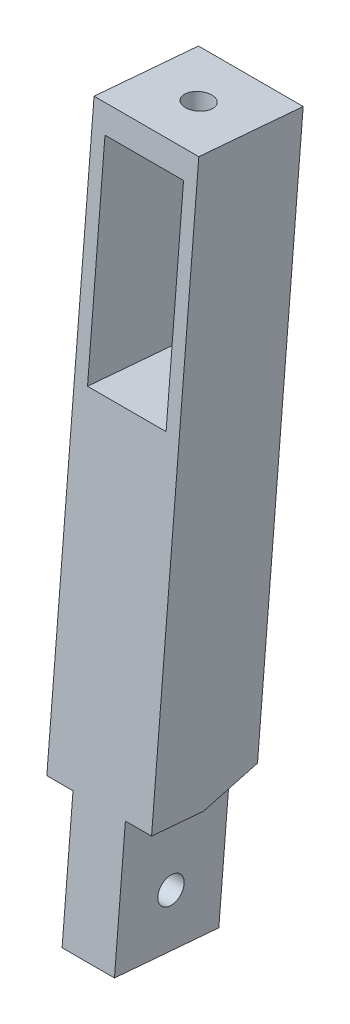
from build123d import *

# Parameters (mm, degrees)
BOSS_EXTRUDE7_START                  = 3.81
SKETCH31_W                           = 68.725
SKETCH31_H                           = 12.7
SKETCH31_W_2                         = 25.4
SKETCH31_H_2                         = 9.525
SKETCH31_W_3                         = 15.875
SKETCH31_H_3                         = 6.35
BOSS_EXTRUDE7_DEPTH                  = 12.7
M3_CLEARANCE_HOLE4_D                 = 3.2
CUT_EXTRUDE3_START                   = 6.35
CUT_EXTRUDE3_DEPTH                   = 3.175
CUT_EXTRUDE4_START                   = -6.35
CUT_EXTRUDE4_DEPTH                   = 3.175
BALL_START                           = 44.54897704
BALL_BALANCER_MASTER_MODEL_OUTLINE_R = 1.6
BALL_BALANCER_MASTER_MODEL_DEPTH     = 3.175


# Read off the part's stored shape, not the designer's step: Ball Balancer Master Model
with BuildPart() as part:
    # Sketch31 → Boss-Extrude7 (new body)
    # profile 1 of 2: a face of its own
    with BuildSketch(Plane(origin=(0, 9.162503731, 109.526818173), x_dir=(0, 0.9965191508346533, -0.08336415308621317), z_dir=(0, 0.08336415308621317, 0.9965191508346533)).offset(BOSS_EXTRUDE7_START)):
        with Locations((13.36147704, 0)):
            Rectangle(SKETCH31_W, SKETCH31_H)
        with Locations((31.84897704, 0)):
            Rectangle(SKETCH31_W_2, SKETCH31_H_2, mode=Mode.SUBTRACT)
    # profile 2 of 2: a face of its own
    with BuildSketch(Plane(origin=(0, 9.162503731, 109.526818173), x_dir=(0, 0.9965191508346533, -0.08336415308621317), z_dir=(0, 0.08336415308621317, 0.9965191508346533)).offset(BOSS_EXTRUDE7_START)):
        with Locations((-28.93852296, 0)):
            Rectangle(SKETCH31_W_3, SKETCH31_H_3)
    extrude(amount=-BOSS_EXTRUDE7_DEPTH)

    # M3 Clearance Hole4 (through all)
    with Locations(Plane.ZY.offset(3.175)):
        with Locations((-85.094578454, 48.544265488), (109.540435581, -21.469007696)):
            Hole(M3_CLEARANCE_HOLE4_D / 2)

    # Sketch35 → Cut-Extrude3 (cut)
    with BuildSketch(Plane.ZY.offset(CUT_EXTRUDE3_START)):
        Polygon((108.746392023, -11.977162785), (102.225823269, -10.203359146), (102.418495416, -12.506525157), align=None)
    extrude(amount=-CUT_EXTRUDE3_DEPTH, mode=Mode.SUBTRACT)

    # Sketch36 → Cut-Extrude4 (cut)
    with BuildSketch(Plane.ZY.offset(CUT_EXTRUDE4_START)):
        Polygon((102.225823269, -10.203359146), (108.746392023, -11.977162785), (102.418495416, -12.506525157), align=None)
    extrude(amount=CUT_EXTRUDE4_DEPTH, mode=Mode.SUBTRACT)

    # Ball Balancer Master Model outline → Ball Balancer Master Model (cut)
    with BuildSketch(Plane(origin=(0, 0, 0), x_dir=(1, 0, 0), z_dir=(0, 0.9965191508346533, -0.08336415308621321)).offset(BALL_START)):
        with Locations((0, -107.369396203)):
            Circle(BALL_BALANCER_MASTER_MODEL_OUTLINE_R)
    extrude(amount=BALL_BALANCER_MASTER_MODEL_DEPTH, mode=Mode.SUBTRACT)


solid = part.part
